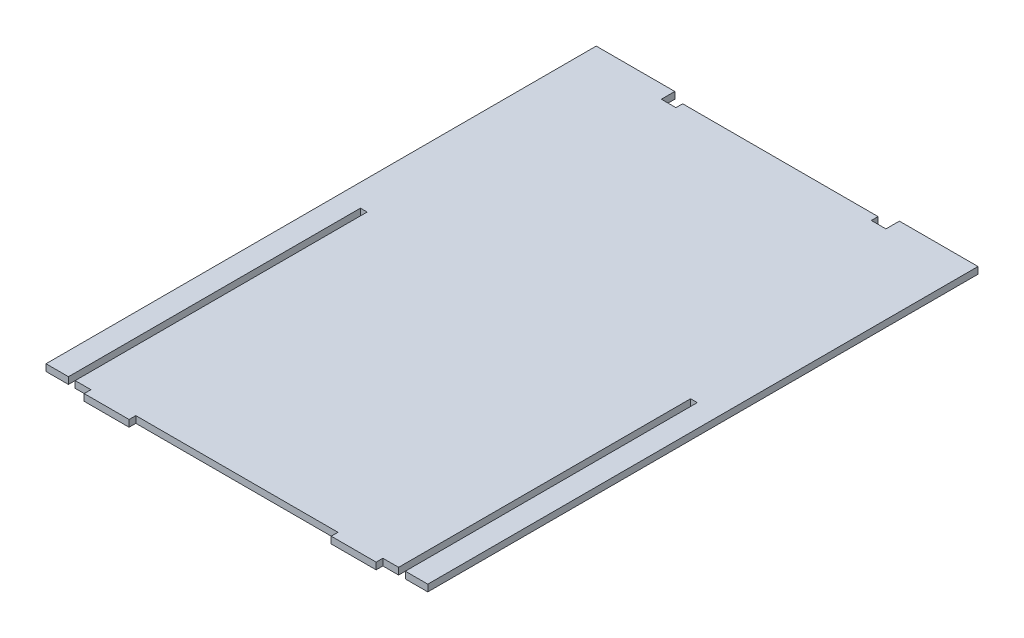
from build123d import *

# Parameters (mm, degrees)
BOSS_EXTRUDE1_DEPTH = 6
SKETCH2_W           = 6
SKETCH2_H           = 260
CUT_EXTRUDE1_DEPTH  = 6
LPATTERN1_COUNT     = 2
LPATTERN1_PITCH     = 294
CUT_EXTRUDE2_DEPTH  = 6


with BuildPart() as part:
    # Sketch1 → Boss-Extrude1 (new body)
    with BuildSketch(Plane(origin=(0, 0, 0), x_dir=(1, 0, 0), z_dir=(0, 1, 0))):
        Polygon((300, 0), (300, -6), (260, -6), (260, 0), (80, 0), (80, -6), (40, -6), (40, 0), (0, 0), (0, 490), (340, 490), (340, 0), align=None)
    extrude(amount=BOSS_EXTRUDE1_DEPTH)

    # Sketch2 → Cut-Extrude1 (cut)
    with BuildSketch(Plane(origin=(0, 6, 0), x_dir=(1, 0, 0), z_dir=(0, 1, 0))):
        with Locations((23, 130)):
            Rectangle(SKETCH2_W, SKETCH2_H)
    cut_extrude1 = extrude(amount=-CUT_EXTRUDE1_DEPTH, mode=Mode.SUBTRACT)

    # LPattern1: Cut-Extrude1 ×2
    with Locations(*[(i * LPATTERN1_PITCH, 0, 0) for i in range(1, LPATTERN1_COUNT)]):
        add(cut_extrude1, mode=Mode.SUBTRACT)

    # Sketch3 → Cut-Extrude2 (cut)
    with BuildSketch(Plane(origin=(0, 6, 0), x_dir=(1, 0, 0), z_dir=(0, 1, 0))):
        Polygon((70, 490), (270, 490), (270, 478), (257, 478), (257, 484), (83, 484), (83, 478), (70, 478), align=None)
    extrude(amount=-CUT_EXTRUDE2_DEPTH, mode=Mode.SUBTRACT)


solid = part.part
